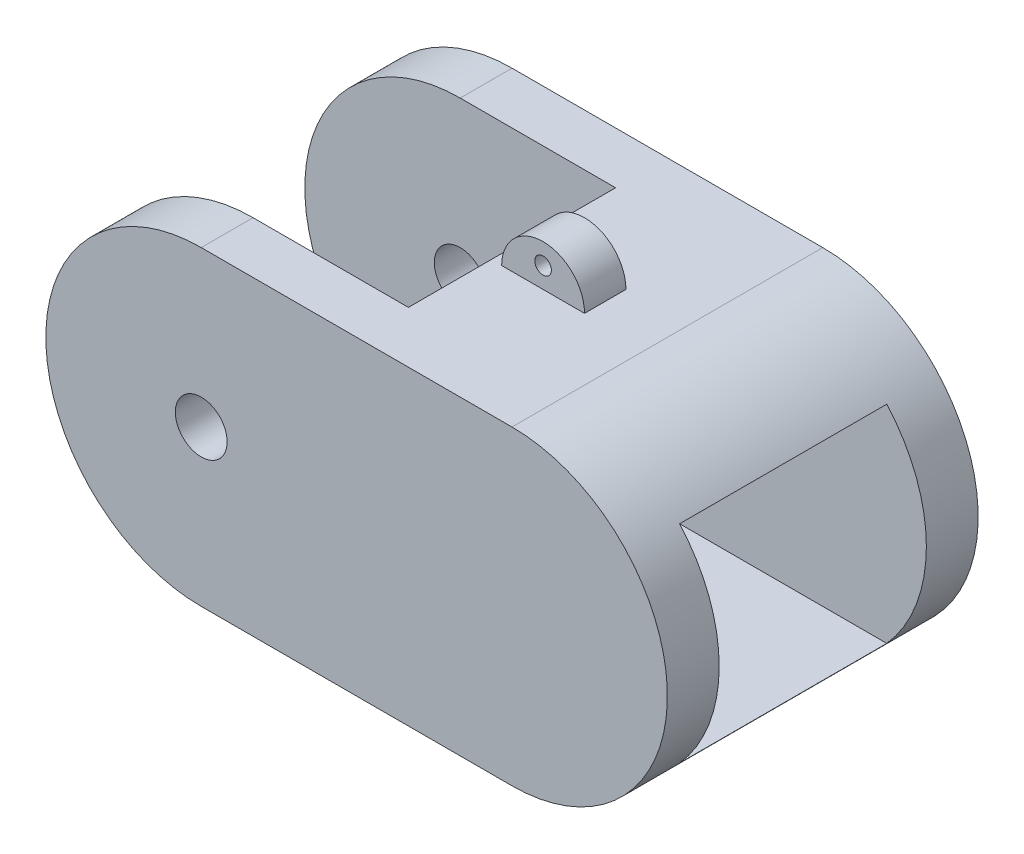
from build123d import *

# Parameters (mm, degrees)
SKETCH1_W           = 38.1
SKETCH1_H           = 19.05
BOSS_EXTRUDE1_DEPTH = 19.05
SKETCH2_R           = 1.5875
CUT_EXTRUDE2_DEPTH  = 19.05
SKETCH3_W           = 16.620070223
SKETCH3_H           = 12.7
CUT_EXTRUDE3_DEPTH  = 19.05
SKETCH4_W           = 12.7
SKETCH4_H           = 12.7
CUT_EXTRUDE4_DEPTH  = 50.8
SKETCH6_W           = 5.08
SKETCH6_H           = 3.81
BOSS_EXTRUDE2_DEPTH = 7.62
CUT_EXTRUDE6_DEPTH  = 19.05
SKETCH8_W           = 5.08
SKETCH8_H           = 2.54
BOSS_EXTRUDE3_DEPTH = 2.54
SKETCH9_R           = 0.508
CUT_EXTRUDE7_DEPTH  = 19.05
SKETCH10_W          = 9.525
SKETCH10_H          = 12.7
CUT_EXTRUDE8_DEPTH  = 3.81


with BuildPart() as part:
    # Sketch1 → Boss-Extrude1 (new body)
    with BuildSketch(Plane(origin=(0, 0, 0), x_dir=(1, 0, 0), z_dir=(0, 1, 0))):
        with Locations((-3.175, 0)):
            Rectangle(SKETCH1_W, SKETCH1_H)
    extrude(amount=BOSS_EXTRUDE1_DEPTH)

    # Sketch2 → Cut-Extrude2 (cut)
    with BuildSketch(Plane.XY.offset(9.525)):
        with Locations((-12.7, 9.525)):
            Circle(SKETCH2_R)
        with BuildLine():
            ThreePointArc((-12.7, 19.05), (-22.225, 9.525), (-12.7, 0))
            ThreePointArc((-12.7, 0), (-33.665146333, 9.525), (-12.7, 19.05))
        make_face()
        with BuildLine():
            ThreePointArc((6.35, 0), (15.875, 9.525), (6.35, 19.05))
            ThreePointArc((6.35, 19.05), (24.948138119, 9.525), (6.35, 0))
        make_face()
    extrude(amount=-CUT_EXTRUDE2_DEPTH, mode=Mode.SUBTRACT)

    # Sketch3 → Cut-Extrude3 (cut)
    with BuildSketch(Plane(origin=(0, 19.05, 0), x_dir=(1, 0, 0), z_dir=(0, 1, 0))):
        with Locations((-21.010035112, 0)):
            Rectangle(SKETCH3_W, SKETCH3_H)
    extrude(amount=-CUT_EXTRUDE3_DEPTH, mode=Mode.SUBTRACT)

    # Sketch4 → Cut-Extrude4 (cut)
    with BuildSketch(Plane(origin=(-15.875, 0, 0), x_dir=(0, 0, -1), z_dir=(1, 0, 0))):
        with Locations((0, 9.525)):
            Rectangle(SKETCH4_W, SKETCH4_H)
    extrude(amount=CUT_EXTRUDE4_DEPTH, mode=Mode.SUBTRACT)

    # Sketch6 → Boss-Extrude2 (add)
    with BuildSketch(Plane(origin=(0, 0, 0), x_dir=(1, 0, 0), z_dir=(0, 1, 0))):
        with Locations((-3.81, 0)):
            Rectangle(SKETCH6_W, SKETCH6_H)
    extrude(amount=-BOSS_EXTRUDE2_DEPTH)

    # Sketch7 → Cut-Extrude6 (cut)
    with BuildSketch(Plane.XY.offset(9.525)):
        with BuildLine():
            Line((-6.35, -2.54), (-6.35, 0))
            ThreePointArc((-6.35, 0), (-3.81, -9.543763037), (-1.27, 0))
            Line((-1.27, 0), (-3.409788843, 0))
            ThreePointArc((-3.409788843, 0), (-4.800807181, -1.039121584), (-5.673773195, -2.54))
            ThreePointArc((-5.673773195, -2.54), (-5.073333547, -3.82212392), (-3.81, -4.461152767))
            ThreePointArc((-3.81, -4.461152767), (-2.519510062, -3.856329433), (-1.895036722, -2.575232796))
            ThreePointArc((-1.895036722, -2.575232796), (-2.112428234, -2.189951454), (-2.526653821, -2.034651919))
            ThreePointArc((-2.526653821, -2.034651919), (-2.886963085, -1.694231845), (-2.546543011, -1.333922582))
            ThreePointArc((-2.546543011, -1.333922582), (-1.658484693, -1.672580577), (-1.27, -2.54))
            ThreePointArc((-1.27, -2.54), (-2.013948776, -4.336051224), (-3.81, -5.08))
            ThreePointArc((-3.81, -5.08), (-5.606051224, -4.336051224), (-6.35, -2.54))
        make_face()
    extrude(amount=-CUT_EXTRUDE6_DEPTH, mode=Mode.SUBTRACT)

    # Sketch8 → Boss-Extrude3 (add)
    with BuildSketch(Plane(origin=(0, 19.05, 0), x_dir=(1, 0, 0), z_dir=(0, 1, 0))):
        Rectangle(SKETCH8_W, SKETCH8_H)
    extrude(amount=BOSS_EXTRUDE3_DEPTH)

    # Sketch9 → Cut-Extrude7 (cut)
    with BuildSketch(Plane.XY.offset(9.525)):
        with Locations((0, 20.32)):
            Circle(SKETCH9_R)
        with BuildLine():
            ThreePointArc((-2.54, 19.05), (0, 21.59), (2.54, 19.05))
            ThreePointArc((2.54, 19.05), (0, 23.383223271), (-2.54, 19.05))
        make_face()
    extrude(amount=-CUT_EXTRUDE7_DEPTH, mode=Mode.SUBTRACT)

    # Sketch10 → Cut-Extrude8 (cut)
    with BuildSketch(Plane(origin=(0, 19.05, 0), x_dir=(1, 0, 0), z_dir=(0, 1, 0))):
        with Locations((-7.9375, 0)):
            Rectangle(SKETCH10_W, SKETCH10_H)
    extrude(amount=-CUT_EXTRUDE8_DEPTH, mode=Mode.SUBTRACT)


solid = part.part
